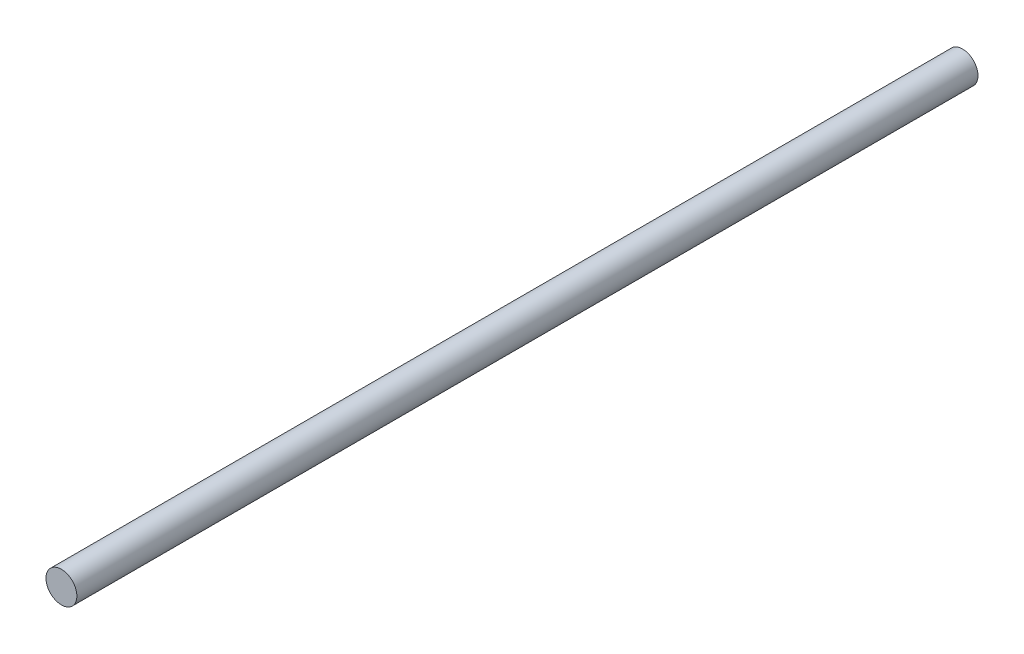
from build123d import *

# Parameters (mm, degrees)
SKIZZE1_R                       = 6
AUFSATZ_LINEAR_AUSTRAGEN1_DEPTH = 350


with BuildPart() as part:
    # Skizze1 → Aufsatz-Linear austragen1 (new body)
    with BuildSketch(Plane.XY):
        Circle(SKIZZE1_R)
    extrude(amount=AUFSATZ_LINEAR_AUSTRAGEN1_DEPTH)


solid = part.part
